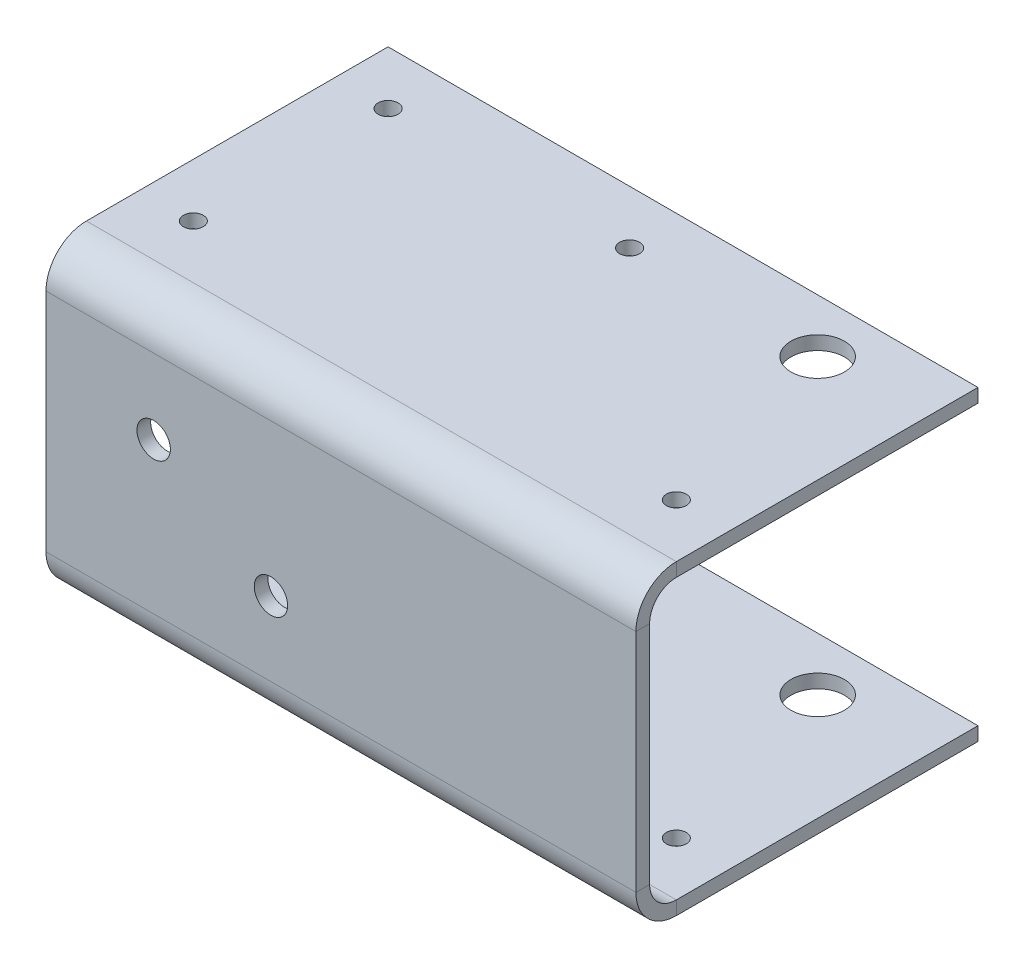
from build123d import *

# Parameters (mm, degrees)
BASE_FLANGE1_DEPTH              = 0.8128
EDGE_FLANGE1_STRIP_W            = 6.4262
EDGE_FLANGE1_STRIP_H            = 0.8128
EDGE_FLANGE1_STRIP_CUT_DEPTH    = 35.042145822
EDGE_FLANGE1_STRIP_2_W          = 6.4262
EDGE_FLANGE1_STRIP_2_H          = 0.8128
EDGE_FLANGE1_STRIP_CUT_2_DEPTH  = 35.042145822
EDGE_FLANGE1_DEPTH              = 35.042145822
EDGE_FLANGE1_BEND_DEPTH         = 35.042145822
F_1_8_0_125_DIAMETER_HOLE1_D    = 3.175
F_56_0_0465_DIAMETER_HOLE1_D    = 1.1811
F_5_64_0_07813_DIAMETER_HOLE1_D = 1.984502


# Sheet-metal steps are written as plain solids
with BuildPart() as part:
    # Sketch1 → Base-Flange1 (new body)
    with BuildSketch(Plane.XY):
        Polygon((-23.044963434, -12.817151558), (5.647182388, -12.817151558), (11.997182388, -12.817151558), (11.997182388, 3.772848442), (5.647182388, 3.772848442), (-23.044963434, 3.772848442), align=None)
    extrude(amount=BASE_FLANGE1_DEPTH)

    # Edge-Flange1 strip (across the edge) → Edge-Flange1 strip cut (cut)
    with BuildSketch(Plane(origin=(-23.044963434, 3.772848442, 0), x_dir=(0, -1, 0), z_dir=(1, 0, 0))):
        with Locations((-1.6256, -0.4064)):
            Rectangle(EDGE_FLANGE1_STRIP_W, EDGE_FLANGE1_STRIP_H)
    extrude(amount=EDGE_FLANGE1_STRIP_CUT_DEPTH, mode=Mode.SUBTRACT)

    # Edge-Flange1 strip 2 (across the edge) → Edge-Flange1 strip cut 2 (cut)
    with BuildSketch(Plane(origin=(11.997182388, -12.817151558, 0), x_dir=(0, 1, 0), z_dir=(-1, 0, 0))):
        with Locations((-1.6256, -0.4064)):
            Rectangle(EDGE_FLANGE1_STRIP_2_W, EDGE_FLANGE1_STRIP_2_H)
    extrude(amount=EDGE_FLANGE1_STRIP_CUT_2_DEPTH, mode=Mode.SUBTRACT)

    # Edge-Flange1 section (across the edge) → Edge-Flange1 (add)
    with BuildSketch(Plane(origin=(-23.044963434, 3.772848442, 0), x_dir=(0, -1, 0), z_dir=(1, 0, 0))):
        with BuildLine():
            Line((-0.8128, 1.5875), (-0.8128, 19.5072))
            Line((-0.8128, 19.5072), (0, 19.5072))
            Line((0, 19.5072), (0, 1.5875))
            ThreePointArc((0, 1.5875), (0.464967985, 0.464967985), (1.5875, 0))
            Line((1.5875, 0), (1.5875, -0.8128))
            ThreePointArc((1.5875, -0.8128), (-0.109768407, -0.109768407), (-0.8128, 1.5875))
        make_face()
    extrude(amount=EDGE_FLANGE1_DEPTH)

    # Edge-Flange1 section 2 (across the edge) → Edge-Flange1 bend (add)
    with BuildSketch(Plane(origin=(11.997182388, -12.817151558, 0), x_dir=(0, 1, 0), z_dir=(-1, 0, 0))):
        with BuildLine():
            Line((-0.8128, 1.5875), (-0.8128, 19.5072))
            Line((-0.8128, 19.5072), (0, 19.5072))
            Line((0, 19.5072), (0, 1.5875))
            ThreePointArc((0, 1.5875), (0.464967985, 0.464967985), (1.5875, 0))
            Line((1.5875, 0), (1.5875, -0.8128))
            ThreePointArc((1.5875, -0.8128), (-0.109768407, -0.109768407), (-0.8128, 1.5875))
        make_face()
    extrude(amount=EDGE_FLANGE1_BEND_DEPTH)

    # 1/8 (0.125) Diameter Hole1 (through all)
    with Locations(Plane(origin=(0, -13.629951558, 0), x_dir=(-1, 0, 0), z_dir=(0, -1, 0))):
        with Locations((-5.647182388, 16.3322)):
            Hole(F_1_8_0_125_DIAMETER_HOLE1_D / 2)

    # #56 (0.0465) Diameter Hole1 (through all)
    with Locations(Plane(origin=(0, -13.629951558, 0), x_dir=(-1, 0, 0), z_dir=(0, -1, 0))):
        with Locations((5.523890523, 16.3322), (19.869963434, 16.3322), (19.869963434, 4.7625), (-8.822182388, 4.7625)):
            Hole(F_56_0_0465_DIAMETER_HOLE1_D / 2)

    # 5/64 (0.07813) Diameter Hole1 (through all)
    with Locations(Plane.XY.offset(0.8128)):
        with Locations((-16.648897162, -2.269651558), (-9.683897162, -6.824651558)):
            Hole(F_5_64_0_07813_DIAMETER_HOLE1_D / 2)


solid = part.part
